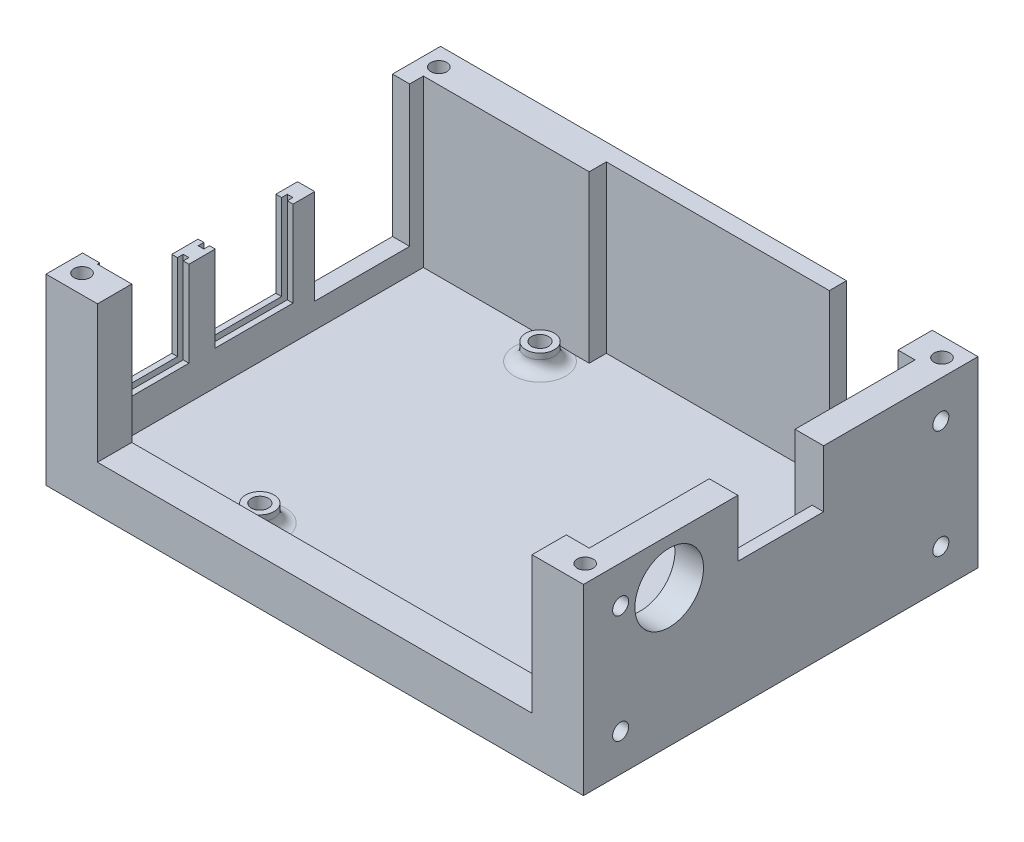
from build123d import *

# Parameters (mm, degrees)
SKETCH1_W                = 94
SKETCH1_H                = 69
PI_BASE_DEPTH            = 3
SKETCH2_W                = 94
SKETCH2_H                = 69
SKETCH2_W_2              = 86
SKETCH2_H_2              = 57
PI_WALLS_DEPTH           = 29
SKETCH4_R                = 2.5
STAND_OFFS_DEPTH         = 3
SKETCH6_R                = 1.5
PI_MOUNT_HOLES_DEPTH     = 6
STANDOFF_FILLET_R        = 2
SKETCH5_W                = 54
SKETCH5_H                = 29
HDMI_AUX_CUT_DEPTH       = 3
SKETCH10_W               = 15
SKETCH10_H               = 29
PWR_CUT_THROUGH_DEPTH    = 3
SKETCH3_W                = 16.6
SKETCH3_H                = 24.6
SKETCH3_W_2              = 13.6
SKETCH3_H_2              = 23
ETH_USB_CUT_DEPTH        = 3
SKETCH8_W                = 1
SKETCH8_H                = 15.6
USB_FLANGE_CUT_DEPTH     = 24
SKETCH16_W               = 15
SKETCH16_H               = 27
SD_CUT_DEPTH             = 3
SKETCH12_R               = 1.4
PCA_MOUNTING_CUT_DEPTH   = 4.4
SKETCH13_R               = 6
CAP_WIRE_HOLE_DEPTH      = 5
SKETCH15_W               = 76
SKETCH15_H               = 24
SIDE_PANEL_CUT_DEPTH     = 6
USB_TOP_TRIM_REACH       = 107.12
SKETCH17_W               = 37.6
SKETCH17_H               = 8
SKETCH18_R               = 1.4
TOP_MOUNTING_HOLES_DEPTH = 5
PCA_POWER_CUT_REACH      = 105.336
SKETCH19_W               = 15
SKETCH19_H               = 10


with BuildPart() as part:
    # Sketch1 → pi_base (new body)
    with BuildSketch(Plane(origin=(0, 0, 0), x_dir=(1, 0, 0), z_dir=(0, 1, 0))):
        Rectangle(SKETCH1_W, SKETCH1_H)
    extrude(amount=PI_BASE_DEPTH)

    # Sketch2 → pi_walls (add)
    with BuildSketch(Plane(origin=(0, 3, 0), x_dir=(1, 0, 0), z_dir=(0, 1, 0))):
        Rectangle(SKETCH2_W, SKETCH2_H)
        with Locations((-1, 0)):
            Rectangle(SKETCH2_W_2, SKETCH2_H_2, mode=Mode.SUBTRACT)
    extrude(amount=PI_WALLS_DEPTH)

    # Sketch4 → stand_offs (add)
    with BuildSketch(Plane(origin=(0, 3, 0), x_dir=(1, 0, 0), z_dir=(0, 1, 0))):
        with Locations(Location((-19.6, 24.5, 0), (0, 0, 270))):
            Circle(SKETCH4_R)
        with Locations(Location((38.4, 24.5, 0), (0, 0, 270))):
            Circle(SKETCH4_R)
        with Locations(Location((-19.6, -24.5, 0), (0, 0, 270))):
            Circle(SKETCH4_R)
        with Locations(Location((38.4, -24.5, 0), (0, 0, 270))):
            Circle(SKETCH4_R)
    extrude(amount=STAND_OFFS_DEPTH)

    # Sketch6 → pi_mount_holes (cut)
    with BuildSketch(Plane(origin=(0, 6, 0), x_dir=(1, 0, 0), z_dir=(0, 1, 0))):
        with Locations(Location((-19.6, 24.5, 0), (0, 0, 270))):
            Circle(SKETCH6_R)
        with Locations(Location((38.4, 24.5, 0), (0, 0, 270))):
            Circle(SKETCH6_R)
        with Locations(Location((-19.6, -24.5, 0), (0, 0, 270))):
            Circle(SKETCH6_R)
        with Locations(Location((38.4, -24.5, 0), (0, 0, 270))):
            Circle(SKETCH6_R)
    extrude(amount=-PI_MOUNT_HOLES_DEPTH, mode=Mode.SUBTRACT)

    # standoff_fillet
    # the kernel refuses this fillet: 2 mm, written as the material it adds along each edge
    with BuildSketch(Plane(origin=(-19.6, 3, -24.5), x_dir=(0, 0, 1), z_dir=(-1, 0, 0))) as standoff_fillet_piece_1:
        with BuildLine():
            CenterArc((2.5 + STANDOFF_FILLET_R, STANDOFF_FILLET_R), STANDOFF_FILLET_R, 180, 90)
            Line((2.5, STANDOFF_FILLET_R), (2.5, 0))
            Line((2.5, 0), (2.5 + STANDOFF_FILLET_R, 0))
        make_face()
    revolve(axis=Axis((-19.6, 3, -24.5), (0, 1, 0)))
    with BuildSketch(Plane(origin=(38.4, 3, -24.5), x_dir=(0, 0, 1), z_dir=(-1, 0, 0))) as standoff_fillet_piece_2:
        with BuildLine():
            CenterArc((2.5 + STANDOFF_FILLET_R, STANDOFF_FILLET_R), STANDOFF_FILLET_R, 180, 90)
            Line((2.5, STANDOFF_FILLET_R), (2.5, 0))
            Line((2.5, 0), (2.5 + STANDOFF_FILLET_R, 0))
        make_face()
    revolve(axis=Axis((38.4, 3, -24.5), (0, 1, 0)))
    with BuildSketch(Plane(origin=(38.4, 3, 24.5), x_dir=(0, 0, 1), z_dir=(-1, 0, 0))) as standoff_fillet_piece_3:
        with BuildLine():
            CenterArc((2.5 + STANDOFF_FILLET_R, STANDOFF_FILLET_R), STANDOFF_FILLET_R, 180, 90)
            Line((2.5, STANDOFF_FILLET_R), (2.5, 0))
            Line((2.5, 0), (2.5 + STANDOFF_FILLET_R, 0))
        make_face()
    revolve(axis=Axis((38.4, 3, 24.5), (0, 1, 0)))
    with BuildSketch(Plane(origin=(-19.6, 3, 24.5), x_dir=(0, 0, 1), z_dir=(-1, 0, 0))) as standoff_fillet_piece_4:
        with BuildLine():
            CenterArc((2.5 + STANDOFF_FILLET_R, STANDOFF_FILLET_R), STANDOFF_FILLET_R, 180, 90)
            Line((2.5, STANDOFF_FILLET_R), (2.5, 0))
            Line((2.5, 0), (2.5 + STANDOFF_FILLET_R, 0))
        make_face()
    revolve(axis=Axis((-19.6, 3, 24.5), (0, 1, 0)))

    # Sketch5 → hdmi_aux_cut (cut)
    with BuildSketch(Plane.XY.offset(-28.5)):
        with Locations((12, 17.5)):
            Rectangle(SKETCH5_W, SKETCH5_H)
    extrude(amount=-HDMI_AUX_CUT_DEPTH, mode=Mode.SUBTRACT)

    # Sketch10 → pwr_cut_through (cut)
    with BuildSketch(Plane.XY.offset(-31.5)):
        with Locations((31.5, 17.5)):
            Rectangle(SKETCH10_W, SKETCH10_H)
    extrude(amount=-PWR_CUT_THROUGH_DEPTH, mode=Mode.SUBTRACT)

    # Sketch3 → eth_usb_cut (cut)
    with BuildSketch(Plane.ZY.offset(47)):
        with Locations((-17.8, 19.7)):
            Rectangle(SKETCH3_W, SKETCH3_H)
        with Locations((1.1, 20.5)):
            Rectangle(SKETCH3_W_2, SKETCH3_H_2)
        with Locations((19.3, 20.5)):
            Rectangle(SKETCH3_W_2, SKETCH3_H_2)
    extrude(amount=-ETH_USB_CUT_DEPTH, mode=Mode.SUBTRACT)

    # Sketch8 → usb_flange_cut (cut)
    with BuildSketch(Plane(origin=(0, 32, 0), x_dir=(1, 0, 0), z_dir=(0, 1, 0))):
        with Locations((-45.5, -1.1)):
            Rectangle(SKETCH8_W, SKETCH8_H)
        with Locations((-45.5, -19.3)):
            Rectangle(SKETCH8_W, SKETCH8_H)
    extrude(amount=-USB_FLANGE_CUT_DEPTH, mode=Mode.SUBTRACT)

    # Sketch16 → sd_cut (cut)
    with BuildSketch(Plane.ZY.offset(-42)):
        with Locations((0, 18.5)):
            Rectangle(SKETCH16_W, SKETCH16_H)
    extrude(amount=-SD_CUT_DEPTH, mode=Mode.SUBTRACT)

    # Sketch12 → pca_mounting_cut (cut)
    with BuildSketch(Plane(origin=(47, 0, 0), x_dir=(0, 0, -1), z_dir=(1, 0, 0))):
        with Locations((-28, 25.5)):
            Circle(SKETCH12_R)
        with Locations((-28, 6.5)):
            Circle(SKETCH12_R)
        with Locations((28, 6.5)):
            Circle(SKETCH12_R)
        with Locations((28, 25.5)):
            Circle(SKETCH12_R)
    extrude(amount=-PCA_MOUNTING_CUT_DEPTH, mode=Mode.SUBTRACT)

    # Sketch13 → cap_wire_hole (cut)
    with BuildSketch(Plane.ZY.offset(-42)):
        with Locations((19.5, 24)):
            Circle(SKETCH13_R)
    extrude(amount=-CAP_WIRE_HOLE_DEPTH, mode=Mode.SUBTRACT)

    # Sketch15 → side_panel_cut (cut)
    with BuildSketch(Plane.XY.offset(34.5)):
        with Locations((0, 20)):
            Rectangle(SKETCH15_W, SKETCH15_H)
    extrude(amount=-SIDE_PANEL_CUT_DEPTH, mode=Mode.SUBTRACT)

    # usb_top_trim: up to this face of the body (flat: up to its plane)
    usb_top_trim_end = Plane(part.part.faces().sort_by_distance((-38, 20, 31.5))[0])
    # Sketch17 → usb_top_trim (cut, up to the picked face)
    with BuildSketch(Plane.ZY.offset(47), mode=Mode.PRIVATE) as usb_top_trim_sk1:
        with Locations((9.3, 28)):
            Rectangle(SKETCH17_W, SKETCH17_H)
    usb_top_trim_tool1 = split(extrude(usb_top_trim_sk1.sketch, amount=-USB_TOP_TRIM_REACH, mode=Mode.PRIVATE), bisect_by=usb_top_trim_end, keep=Keep.BOTH, mode=Mode.PRIVATE)
    add(usb_top_trim_tool1.solids().sort_by(Axis((-47, 28, 9.3), (1, 0, 0)))[0], mode=Mode.SUBTRACT)

    # Sketch18 → top_mounting_holes (cut)
    with BuildSketch(Plane(origin=(0, 32, 0), x_dir=(1, 0, 0), z_dir=(0, 1, 0))):
        with Locations(Location((-44, 31.2, 0), (0, 0, 270))):
            Circle(SKETCH18_R)
        with Locations(Location((44, 31.2, 0), (0, 0, 270))):
            Circle(SKETCH18_R)
        with Locations(Location((44, -31.2, 0), (0, 0, 270))):
            Circle(SKETCH18_R)
        with Locations(Location((-44, -31.2, 0), (0, 0, 270))):
            Circle(SKETCH18_R)
    extrude(amount=-TOP_MOUNTING_HOLES_DEPTH, mode=Mode.SUBTRACT)

    # Sketch19 → pca_power_cut (cut, up to next)
    with BuildSketch(Plane.ZY.offset(-45), mode=Mode.PRIVATE) as pca_power_cut_sk1:
        with Locations((0, 27)):
            Rectangle(SKETCH19_W, SKETCH19_H)
    pca_power_cut_tool1 = extrude(pca_power_cut_sk1.sketch, amount=-PCA_POWER_CUT_REACH, mode=Mode.PRIVATE) & part.part
    add(pca_power_cut_tool1.solids().sort_by_distance((45, 27, 0))[0], mode=Mode.SUBTRACT)


solid = part.part
